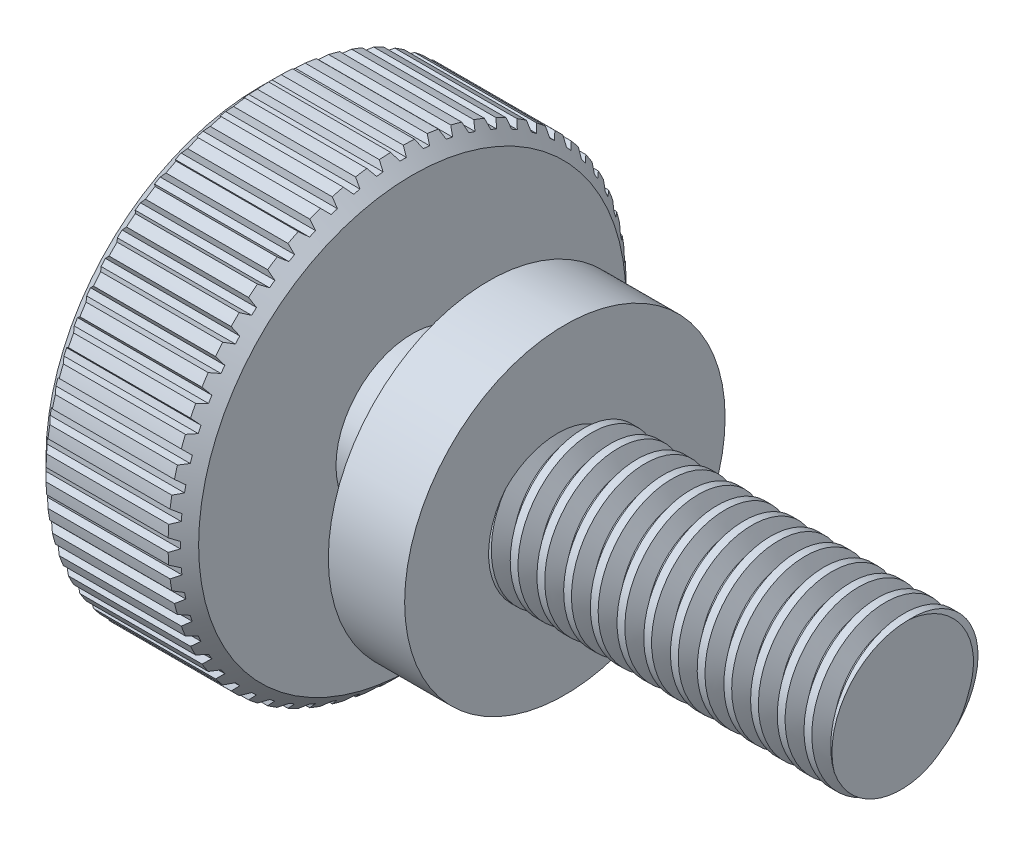
from build123d import *

# Parameters (mm, degrees)
CUT_SWEEP1_PITCH   = 0.7
CUT_SWEEP1_TO      = 9
CHAMFER1_SIZE      = 0.4
CUT_EXTRUDE1_REACH = 21
CIRPATTERN1_COUNT  = 60


with BuildPart() as part:
    # Sketch1 → Revolve1 (revolve)
    with BuildSketch(Plane.XY, mode=Mode.PRIVATE) as revolve1_sk:
        Polygon((17, 0), (17, 2), (8, 2), (8, 4.2), (6, 4.2), (6, 2), (4, 2), (4, 6), (0, 6), (0, 0), align=None)
    revolve(revolve1_sk.sketch.rotate(Axis((-16.113670608, 0, 0), (1, 0, 0)), 90), axis=Axis((-16.113670608, 0, 0), (1, 0, 0)))

    # Cut-Sweep1: arcs per turn and ends read off the stored shape
    # Cut-Sweep1: the profile of m4 thread profile screwed along a right-hand helix through 14.666667 turns, 6 arcs to a turn; built about Z, then put on its axis
    cut_sweep1_z = Axis((0, 0, 0), (0, 0, 1))
    cut_sweep1_corners = [(1.637192984, 0, -0.909466728), (1.637192984, 0, -0.986477153), (2.01702542, 0, -1.205773512), (2.01702542, 0, -0.690170369)]
    with BuildLine(mode=Mode.PRIVATE) as cut_sweep1_profile:
        Line(cut_sweep1_corners[0], cut_sweep1_corners[1])
        Line(cut_sweep1_corners[1], cut_sweep1_corners[2])
        Line(cut_sweep1_corners[2], cut_sweep1_corners[3])
        Line(cut_sweep1_corners[3], cut_sweep1_corners[0])
    cut_sweep1_cap = Face(cut_sweep1_profile.wire())
    cut_sweep1_turn_angles = [0, 30, 60, 90, 120, 150, 180, 210, 240, 270, 300, 330, 360]
    cut_sweep1_turn_weights = [1, 0.8660254037844387, 1, 0.8660254037844387, 1, 0.8660254037844387, 1, 0.8660254037844387, 1, 0.8660254037844387, 1, 0.8660254037844387, 1]
    cut_sweep1_turn_rails = [Edge.make_bspline([Vector(p[0], p[1], 0).rotate(cut_sweep1_z, cut_sweep1_turn_angles[k]) / cut_sweep1_turn_weights[k] + Vector(0, 0, p[2] + CUT_SWEEP1_PITCH * cut_sweep1_turn_angles[k] / 360) for k in range(13)], [0, 0, 0, 1, 1, 2, 2, 3, 3, 4, 4, 5, 5, 6, 6, 6], 2, cut_sweep1_turn_weights) for p in cut_sweep1_corners]
    cut_sweep1_turn_sides = [Face.make_surface_from_curves(cut_sweep1_turn_rails[p[0]], cut_sweep1_turn_rails[p[1]]) for p in [(0, 1), (1, 2), (2, 3), (3, 0)]]
    cut_sweep1_last_angles = [5040, 5070, 5100, 5130, 5160, 5190, 5220, 5250, 5280]
    cut_sweep1_last_weights = [1, 0.8660254037844387, 1, 0.8660254037844387, 1, 0.8660254037844387, 1, 0.8660254037844387, 1]
    cut_sweep1_last_rails = [Edge.make_bspline([Vector(p[0], p[1], 0).rotate(cut_sweep1_z, cut_sweep1_last_angles[k]) / cut_sweep1_last_weights[k] + Vector(0, 0, p[2] + CUT_SWEEP1_PITCH * cut_sweep1_last_angles[k] / 360) for k in range(9)], [0, 0, 0, 1, 1, 2, 2, 3, 3, 4, 4, 4], 2, cut_sweep1_last_weights) for p in cut_sweep1_corners]
    cut_sweep1_last_sides = [Face.make_surface_from_curves(cut_sweep1_last_rails[p[0]], cut_sweep1_last_rails[p[1]]) for p in [(0, 1), (1, 2), (2, 3), (3, 0)]]
    cut_sweep1 = Plane(origin=(17, 0, 0), x_dir=(0, 1, 0), z_dir=(-1, 0, 0)) * split(Solid(Shell([*[p.moved(Location((0, 0, CUT_SWEEP1_PITCH * i))) for i in range(14) for p in cut_sweep1_turn_sides], *cut_sweep1_last_sides, cut_sweep1_cap, cut_sweep1_cap.rotate(cut_sweep1_z, 5280).moved(Location((0, 0, CUT_SWEEP1_PITCH * 5280 / 360)))])), bisect_by=Plane.XY.offset(CUT_SWEEP1_TO), keep=Keep.BOTTOM, mode=Mode.PRIVATE)
    add(cut_sweep1, mode=Mode.SUBTRACT)

    # Chamfer1
    chamfer1_edges = [part.edges().sort_by_distance(p)[0] for p in [
        (0, 0, -6),
        (4, 0, -6),
    ]]
    chamfer(chamfer1_edges, length=CHAMFER1_SIZE)

    # Cut-Extrude1: up to this cone (the profile starts inside it)
    cut_extrude1_end = Plane(origin=(0, 0, 0), z_dir=(-1, 0, 0)).offset(-9.599999) * Cone(1e-06, 40.7, 40.699999, align=(Align.CENTER, Align.CENTER, Align.MIN), mode=Mode.PRIVATE)
    # Sketch5 → Cut-Extrude1 (cut, up to the surface)
    with BuildSketch(Plane.ZY, mode=Mode.PRIVATE) as cut_extrude1_sk1:
        with BuildLine():
            Line((-0.08508507, 5.839), (0.08508507, 5.839))
            Line((0.08508507, 5.839), (0.165, 5.997730821))
            ThreePointArc((0.165, 5.997730821), (0, 6), (-0.165, 5.997730821))
            Line((-0.165, 5.997730821), (-0.08508507, 5.839))
        make_face()
    cut_extrude1_tool1 = extrude(cut_extrude1_sk1.sketch, amount=-CUT_EXTRUDE1_REACH, mode=Mode.PRIVATE) & cut_extrude1_end
    cut_extrude1 = cut_extrude1_tool1.solids().sort_by_distance((0, 5.927711, 0))[0]
    add(cut_extrude1, mode=Mode.SUBTRACT)

    # CirPattern1: Cut-Extrude1 ×60 about axis
    cirpattern1_axis = Axis((0, 0, 0), (1, 0, 0))
    for i in range(1, CIRPATTERN1_COUNT):
        add(cut_extrude1.rotate(cirpattern1_axis, i * 360 / CIRPATTERN1_COUNT), mode=Mode.SUBTRACT)


solid = part.part
